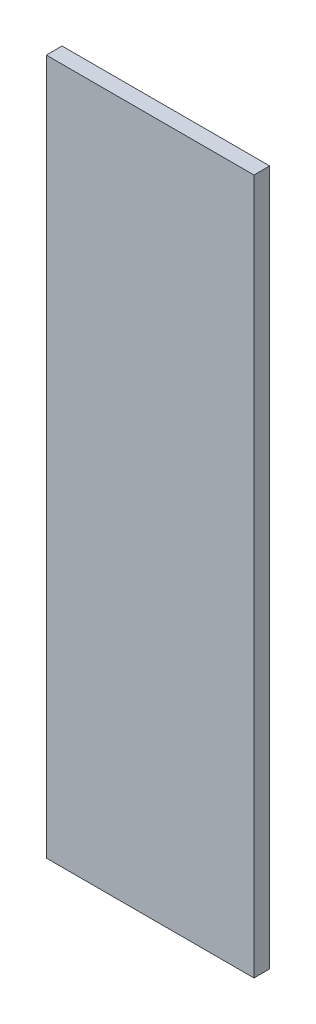
from build123d import *

# Parameters (mm, degrees)
SKETCH1_W           = 132
SKETCH1_H           = 442
BOSS_EXTRUDE1_DEPTH = 5


with BuildPart() as part:
    # Sketch1 → Boss-Extrude1 (new, symmetric)
    with BuildSketch(Plane.XY):
        Rectangle(SKETCH1_W, SKETCH1_H)
    extrude(amount=BOSS_EXTRUDE1_DEPTH, both=True)


solid = part.part
